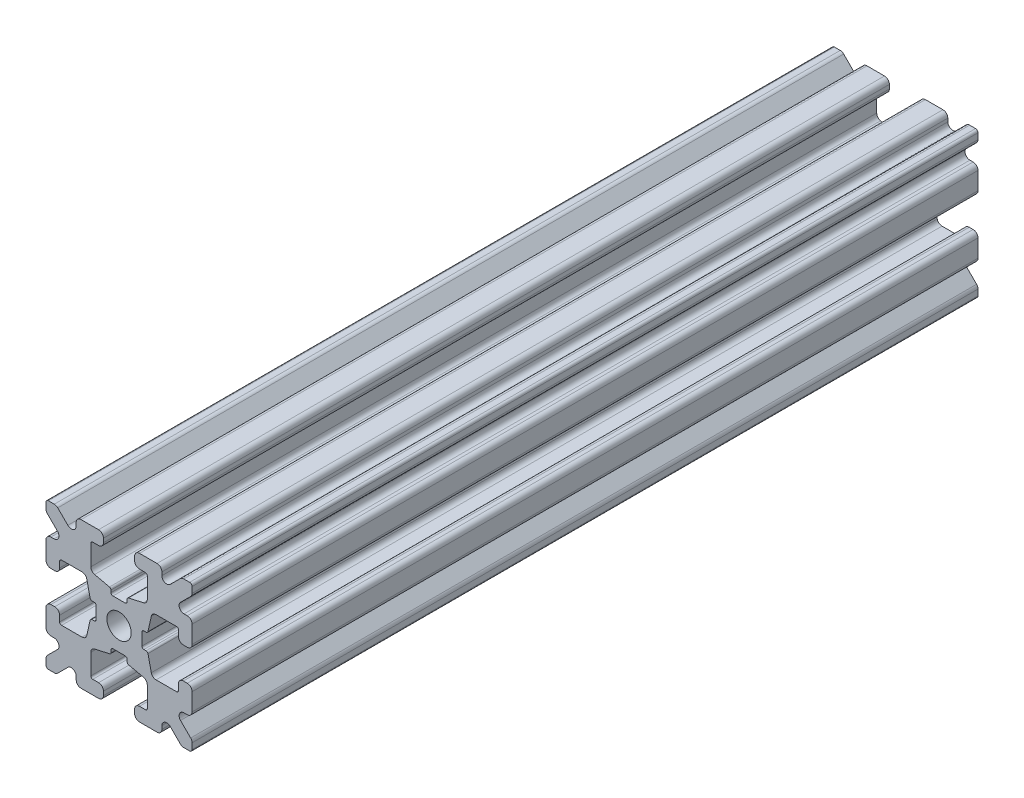
from build123d import *

# Parameters (mm, degrees)
SKETCH1_W           = 15
SKETCH1_H           = 15
SKETCH1_R           = 1.25
BOSS_EXTRUDE1_DEPTH = 40.35
FILLET1_R           = 0.25
CUT_EXTRUDE1_DEPTH  = 82.394041551
CUT_EXTRUDE3_DEPTH  = 82.394041551
FILLET3_R           = 0.5
FILLET4_R           = 0.5
FILLET5_R           = 3
FILLET6_R           = 0.2
CUT_EXTRUDE4_DEPTH  = 82.394041551
FILLET8_R           = 0.5
SKETCH6_W           = 5.1529354
SKETCH6_H           = 1.651
SKETCH6_W_2         = 1.651
SKETCH6_H_2         = 5.1529354
CUT_EXTRUDE5_DEPTH  = 82.394041551
FILLET10_R          = 0.2


with BuildPart() as part:
    # Sketch1 → Boss-Extrude1 (new, symmetric)
    with BuildSketch(Plane.XY):
        Rectangle(SKETCH1_W, SKETCH1_H)
        Circle(SKETCH1_R, mode=Mode.SUBTRACT)
    extrude(amount=BOSS_EXTRUDE1_DEPTH, both=True)

    # Fillet1
    fillet1_edges = [part.edges().sort_by_distance(p)[0] for p in [
        (7.5, -7.5, 0),
        (-7.5, -7.5, 0),
        (7.5, 7.5, 0),
        (-7.5, 7.5, 0),
    ]]
    fillet(fillet1_edges, radius=FILLET1_R)

    # Sketch2 → Cut-Extrude1 (cut, through all)
    with BuildSketch(Plane.XY.offset(40.35)):
        Polygon((-7.5, 1.6), (-6.1, 1.6), (-6.1, 2.9), (-3.4, 2.9), (-3.4, -2.9), (-6.1, -2.9), (-6.1, -1.6), (-7.5, -1.6), align=None)
        Polygon((2.9, 6.1), (1.6, 6.1), (1.6, 7.5), (-1.6, 7.5), (-1.6, 6.1), (-2.9, 6.1), (-2.9, 3.4), (2.9, 3.4), align=None)
        Polygon((-1.6, -7.5), (-1.6, -6.1), (-2.9, -6.1), (-2.9, -3.4), (2.9, -3.4), (2.9, -6.1), (1.6, -6.1), (1.6, -7.5), align=None)
        Polygon((6.1, -2.9), (6.1, -1.6), (7.5, -1.6), (7.5, 1.6), (6.1, 1.6), (6.1, 2.9), (3.4, 2.9), (3.4, -2.9), align=None)
    extrude(amount=-CUT_EXTRUDE1_DEPTH, mode=Mode.SUBTRACT)

    # Sketch4 → Cut-Extrude3 (cut, through all)
    with BuildSketch(Plane.XY.offset(40.35)):
        Polygon((-3.4, 2.9), (-2.75, 0), (-3.4, -2.9), align=None)
        Polygon((-2.9, 3.4), (0, 2.75), (2.9, 3.4), align=None)
        Polygon((3.4, 2.9), (2.75, 0), (3.4, -2.9), align=None)
        Polygon((-2.9, -3.4), (0, -2.75), (2.9, -3.4), align=None)
    extrude(amount=-CUT_EXTRUDE3_DEPTH, mode=Mode.SUBTRACT)

    # Fillet3
    fillet3_edges = [part.edges().sort_by_distance(p)[0] for p in [
        (-6.1, -1.6, 0),
        (-7.5, -1.6, 0),
        (-6.1, 1.6, 0),
        (-7.5, 1.6, 0),
        (-1.6, -7.5, 0),
        (-1.6, -6.1, 0),
        (1.6, -7.5, 0),
        (1.6, -6.1, 0),
        (6.1, -1.6, 0),
        (7.5, -1.6, 0),
        (7.5, 1.6, 0),
        (6.1, 1.6, 0),
        (1.6, 7.5, 0),
        (1.6, 6.1, 0),
        (-1.6, 7.5, 0),
        (-1.6, 6.1, 0),
    ]]
    fillet(fillet3_edges, radius=FILLET3_R)

    # Fillet4
    fillet4_edges = [part.edges().sort_by_distance(p)[0] for p in [
        (-3.4, 2.9, 0),
        (-3.4, -2.9, 0),
        (2.9, -3.4, 0),
        (-2.9, -3.4, 0),
        (3.4, -2.9, 0),
        (3.4, 2.9, 0),
        (-2.9, 3.4, 0),
        (2.9, 3.4, 0),
    ]]
    fillet(fillet4_edges, radius=FILLET4_R)

    # Fillet5
    fillet5_edges = [part.edges().sort_by_distance(p)[0] for p in [
        (0, -2.75, 0),
        (2.75, 0, 0),
        (-2.75, 0, 0),
        (0, 2.75, 0),
    ]]
    fillet(fillet5_edges, radius=FILLET5_R)

    # Fillet6
    fillet6_edges = [part.edges().sort_by_distance(p)[0] for p in [
        (-2.9, -6.1, 0),
        (2.9, -6.1, 0),
        (6.1, -2.9, 0),
        (6.1, 2.9, 0),
        (2.9, 6.1, 0),
        (-2.9, 6.1, 0),
        (-6.1, -2.9, 0),
        (-6.1, 2.9, 0),
    ]]
    fillet(fillet6_edges, radius=FILLET6_R)

    # Sketch5 → Cut-Extrude4 (cut, through all)
    with BuildSketch(Plane.XY.offset(40.35)):
        Polygon((-7.5, 6.439339828), (-5.460660172, 4.4), (-7.5, 4.4), align=None)
        Polygon((-6.439339828, 7.5), (-4.4, 5.460660172), (-4.4, 7.5), align=None)
        Polygon((4.4, 7.5), (6.439339828, 7.5), (4.4, 5.460660172), align=None)
        Polygon((7.5, 6.439339828), (7.5, 4.4), (5.460660172, 4.4), align=None)
        Polygon((7.5, -6.439339828), (5.460660172, -4.4), (7.5, -4.4), align=None)
        Polygon((6.439339828, -7.5), (4.4, -5.460660172), (4.4, -7.5), align=None)
        Polygon((-4.4, -7.5), (-6.439339828, -7.5), (-4.4, -5.460660172), align=None)
        Polygon((-7.5, -6.439339828), (-7.5, -4.4), (-5.460660172, -4.4), align=None)
    extrude(amount=-CUT_EXTRUDE4_DEPTH, mode=Mode.SUBTRACT)

    # Fillet8
    fillet8_edges = [part.edges().sort_by_distance(p)[0] for p in [
        (-5.460660172, 4.4, 0),
        (-7.5, 4.4, 0),
        (-5.460660172, -4.4, 0),
        (-7.5, -4.4, 0),
        (-4.4, -7.5, 0),
        (-4.4, -5.460660172, 0),
        (4.4, -7.5, 0),
        (4.4, -5.460660172, 0),
        (5.460660172, -4.4, 0),
        (7.5, -4.4, 0),
        (7.5, 4.4, 0),
        (5.460660172, 4.4, 0),
        (4.4, 5.460660172, 0),
        (4.4, 7.5, 0),
        (-4.4, 5.460660172, 0),
        (-4.4, 7.5, 0),
        (-6.439339828, 7.5, 0),
        (-7.5, 6.439339828, 0),
        (6.439339828, 7.5, 0),
        (7.5, 6.439339828, 0),
        (6.439339828, -7.5, 0),
        (7.5, -6.439339828, 0),
        (-6.439339828, -7.5, 0),
        (-7.5, -6.439339828, 0),
    ]]
    fillet(fillet8_edges, radius=FILLET8_R)

    # Sketch6 → Cut-Extrude5 (cut, through all)
    with BuildSketch(Plane.XY.offset(40.35)):
        with Locations((4.9235323, 0)):
            Rectangle(SKETCH6_W, SKETCH6_H)
        with Locations((0, -4.9235323)):
            Rectangle(SKETCH6_W_2, SKETCH6_H_2)
        with Locations((-4.9235323, 0)):
            Rectangle(SKETCH6_W, SKETCH6_H)
        with Locations((0, 4.9235323)):
            Rectangle(SKETCH6_W_2, SKETCH6_H_2)
    extrude(amount=-CUT_EXTRUDE5_DEPTH, mode=Mode.SUBTRACT)

    # Fillet10
    fillet10_edges = [part.edges().sort_by_distance(p)[0] for p in [
        (-2.935025862, 0.8255, 0),
        (-2.935025862, -0.8255, 0),
        (2.935025862, -0.8255, 0),
        (2.935025862, 0.8255, 0),
        (0.8255, 2.935025862, 0),
        (-0.8255, 2.935025862, 0),
        (-2.3470646, 0.8255, 0),
        (-2.3470646, -0.8255, 0),
        (0.8255, 2.3470646, 0),
        (-0.8255, 2.3470646, 0),
        (2.3470646, 0.8255, 0),
        (2.3470646, -0.8255, 0),
        (0.8255, -2.935025862, 0),
        (0.8255, -2.3470646, 0),
        (-0.8255, -2.3470646, 0),
        (-0.8255, -2.935025862, 0),
    ]]
    fillet(fillet10_edges, radius=FILLET10_R)


solid = part.part
